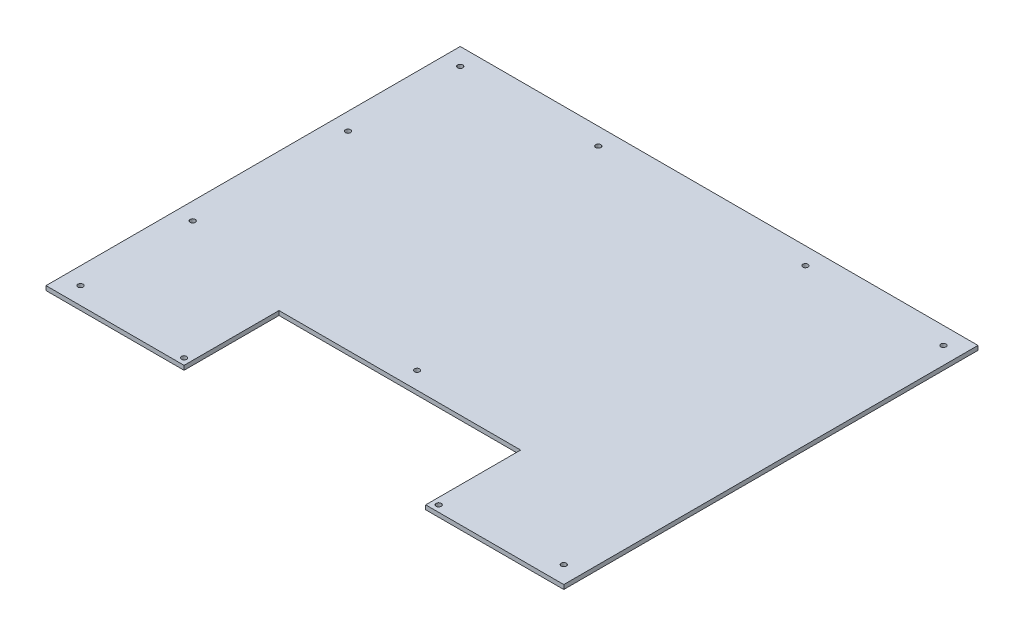
from build123d import *

# Parameters (mm, degrees)
BOSS_EXTRUDE1_DEPTH   = 3.175
F_6_CLEARANCE_HOLE1_D = 3.7973


with BuildPart() as part:
    # Sketch1 → Boss-Extrude1 (new body)
    with BuildSketch(Plane(origin=(0, 0, 0), x_dir=(1, 0, 0), z_dir=(0, 1, 0))):
        Polygon((-190.5, -152.4), (-88.9, -152.4), (-88.9, -82.55), (88.9, -82.55), (88.9, -152.4), (190.5, -152.4), (190.5, 152.4), (-190.5, 152.4), align=None)
    extrude(amount=BOSS_EXTRUDE1_DEPTH)

    # #6 Clearance Hole1 (through all)
    with Locations(Plane(origin=(-76.2, 3.175, -139.7), x_dir=(0, 0, 1), z_dir=(0, 1, 0))):
        with Locations((0, 0), (0, 152.4), (209.55, 76.2), (287.3248, -17.4752), (279.4, -101.6), (0, -101.6), (0, 254), (279.4, 254), (287.3248, 169.8752), (82.55, -101.6), (196.85, -101.6)):
            Hole(F_6_CLEARANCE_HOLE1_D / 2)


solid = part.part
